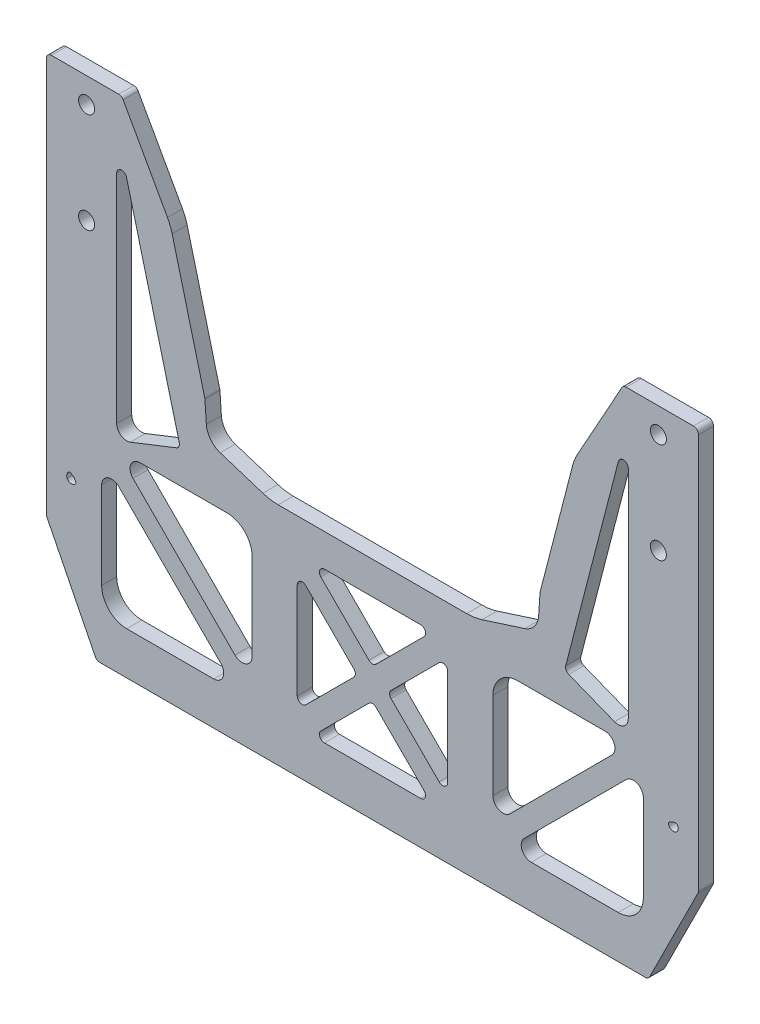
from build123d import *

# Parameters (mm, degrees)
SKETCH_1_W              = 130
SKETCH_1_H              = 100
EXTRUDE_1_DEPTH         = 3
CHAMFER_1_SIZE          = 10
CHAMFER_1_SIZE2         = 20
CHAMFER_2_SIZE          = 20
CHAMFER_2_SIZE2         = 10
SKETCH_2_R              = 1.6
CUT_EXTRUDE_1_DEPTH     = 83.060952956
CUT_EXTRUDE_2_DEPTH     = 83.060952956
CHAMFER_3_SIZE          = 10
FILLET_2_R              = 5
CUT_EXTRUDE_6_DEPTH     = 10
FILLET_5_R              = 10
SKETCH_11_W             = 30
SKETCH_11_H             = 30
CUT_EXTRUDE_7_DEPTH     = 10
FILLET_6_R              = 5
EXTRUDE_2_DEPTH         = 3
FILLET_7_R              = 1
CUT_EXTRUDE_8_DEPTH     = 10
FILLET_8_R              = 1
FILLET_9_DEPTH          = 3
MIRROR_1_DEPTH          = 3
EXTRUDE_3_DEPTH         = 3
FILLET_10_R             = 2
CUT_EXTRUDE_9_DEPTH     = 10
FILLET_11_R             = 4
FILLET_11_OF_MIRROR_3_R = 4
FILLET_12_R             = 1


with BuildPart() as part:
    # 草图1 → 凸台-拉伸1 (new body)
    with BuildSketch(Plane.XY):
        Rectangle(SKETCH_1_W, SKETCH_1_H)
    extrude(amount=EXTRUDE_1_DEPTH)

    # 倒角1
    chamfer_1_edges = [part.edges().sort_by_distance(p)[0] for p in [
        (65, -50, 1.5),
    ]]
    chamfer_1_side = [part.faces().sort_by_distance(p)[0] for p in [
        (0, -50, 1.5),
    ]]
    chamfer(chamfer_1_edges, length=CHAMFER_1_SIZE, length2=CHAMFER_1_SIZE2, reference=chamfer_1_side[0])

    # 倒角2
    chamfer_2_edges = [part.edges().sort_by_distance(p)[0] for p in [
        (-65, -50, 1.5),
    ]]
    chamfer_2_side = [part.faces().sort_by_distance(p)[0] for p in [
        (-65, 0, 1.5),
    ]]
    chamfer(chamfer_2_edges, length=CHAMFER_2_SIZE, length2=CHAMFER_2_SIZE2, reference=chamfer_2_side[0])

    # 草图2 → 切除-拉伸1 (cut, through all)
    with BuildSketch(Plane.XY.offset(3)):
        with Locations((57, 45)):
            Circle(SKETCH_2_R)
        with Locations((57, 25)):
            Circle(SKETCH_2_R)
        with Locations(Location((-57, 25, 0), (0, 0, 180))):
            Circle(SKETCH_2_R)
        with Locations(Location((-57, 45, 0), (0, 0, 180))):
            Circle(SKETCH_2_R)
    extrude(amount=-CUT_EXTRUDE_1_DEPTH, mode=Mode.SUBTRACT)

    # 草图3 → 切除-拉伸2 (cut, through all)
    with BuildSketch(Plane.XY.offset(3)):
        Polygon((-50, 50), (-25, 5), (25, 5), (50, 50), align=None)
    extrude(amount=-CUT_EXTRUDE_2_DEPTH, mode=Mode.SUBTRACT)

    # 倒角3
    chamfer_3_edges = [part.edges().sort_by_distance(p)[0] for p in [
        (25, 5, 1.5),
        (-25, 5, 1.5),
    ]]
    chamfer(chamfer_3_edges, length=CHAMFER_3_SIZE)

    # 圆角2
    fillet_2_edges = [part.edges().sort_by_distance(p)[0] for p in [
        (29.856429312, 13.741572761, 1.5),
        (-15, 5, 1.5),
        (15, 5, 1.5),
        (-29.856429312, 13.741572761, 1.5),
    ]]
    fillet(fillet_2_edges, radius=FILLET_2_R)

    # 草图9 → 切除-拉伸6 (cut)
    with BuildSketch(Plane(origin=(0, 0, 0), x_dir=(-1, 0, 0), z_dir=(0, 0, -1))):
        Polygon((-8.056483751, -5), (8.056483751, -5), (22, -5), (32.5, 2.5), (40.258907557, 32.466033603), (-40.258907557, 32.466033603), (-32.5, 2.5), (-22, -5), align=None)
    extrude(amount=-CUT_EXTRUDE_6_DEPTH, mode=Mode.SUBTRACT)

    # 圆角5
    fillet_5_edges = [part.edges().sort_by_distance(p)[0] for p in [
        (-40.258907557, 32.466033603, 1.5),
        (22, -5, 1.5),
        (32.5, 2.5, 1.5),
        (40.258907557, 32.466033603, 1.5),
        (-32.5, 2.5, 1.5),
        (-22, -5, 1.5),
    ]]
    fillet(fillet_5_edges, radius=FILLET_5_R)

    # 草图11 → 切除-拉伸7 (cut)
    with BuildSketch(Plane(origin=(0, 0, 0), x_dir=(-1, 0, 0), z_dir=(0, 0, -1))):
        with Locations((0, -26.5)):
            Rectangle(SKETCH_11_W, SKETCH_11_H)
        with Locations((39, -26.5)):
            Rectangle(SKETCH_11_W, SKETCH_11_H)
        with Locations((-39, -26.5)):
            Rectangle(SKETCH_11_W, SKETCH_11_H)
    extrude(amount=-CUT_EXTRUDE_7_DEPTH, mode=Mode.SUBTRACT)

    # 圆角6
    fillet_6_edges = [part.edges().sort_by_distance(p)[0] for p in [
        (24, -11.5, 1.5),
        (24, -41.5, 1.5),
        (54, -41.5, 1.5),
        (54, -11.5, 1.5),
        (-54, -11.5, 1.5),
        (-54, -41.5, 1.5),
        (-24, -41.5, 1.5),
        (-24, -11.5, 1.5),
    ]]
    fillet(fillet_6_edges, radius=FILLET_6_R)

    # 草图12 → 凸台-拉伸2 (add)
    with BuildSketch(Plane.XY.offset(3)):
        Polygon((0, -23.5), (-12, -11.5), (-15, -14.5), (-3, -26.5), align=None)
        Polygon((-15, -14.5), (-12, -11.5), (-15, -11.5), align=None)
        Polygon((3, -26.5), (0, -23.5), (-3, -26.5), (0, -29.5), align=None)
        Polygon((15, -38.5), (3, -26.5), (0, -29.5), (12, -41.5), align=None)
        Polygon((12, -11.5), (0, -23.5), (3, -26.5), (15, -14.5), align=None)
        Polygon((15, -11.5), (12, -11.5), (15, -14.5), align=None)
        Polygon((15, -41.5), (15, -38.5), (12, -41.5), align=None)
        Polygon((0, -29.5), (-3, -26.5), (-15, -38.5), (-12, -41.5), align=None)
        Polygon((-12, -41.5), (-15, -38.5), (-15, -41.5), align=None)
    extrude(amount=-EXTRUDE_2_DEPTH)

    # 圆角7
    fillet_7_edges = [part.edges().sort_by_distance(p)[0] for p in [
        (-3, -26.5, 1.5),
        (-15, -14.5, 1.5),
        (-12, -11.5, 1.5),
        (0, -23.5, 1.5),
        (12, -11.5, 1.5),
        (15, -14.5, 1.5),
        (3, -26.5, 1.5),
        (15, -38.5, 1.5),
        (12, -41.5, 1.5),
        (0, -29.5, 1.5),
        (-12, -41.5, 1.5),
        (-15, -38.5, 1.5),
    ]]
    fillet(fillet_7_edges, radius=FILLET_7_R)

    # 草图13 → 切除-拉伸8 (cut)
    with BuildSketch(Plane.XY.offset(3)):
        Polygon((-51, -10), (-51, 44.02839295), (-38.305401388, -5), align=None)
        Polygon((-61.351808176, -20.525873817), (-59, -19.599571123), (-59, -25.229490169), align=None)
    extrude(amount=-CUT_EXTRUDE_8_DEPTH, mode=Mode.SUBTRACT)

    # 圆角8
    # the kernel refuses this fillet: 1 mm, written as the material it adds along each edge
    with BuildSketch(Plane(origin=(-59, -25.229490169, 3), x_dir=(0, 1, 0), z_dir=(0, 0, -1))) as fillet_8_piece_1:
        with BuildLine():
            CenterArc((FILLET_8_R * 4.2360679775, -FILLET_8_R), FILLET_8_R, 90, 153.434948823)
            Line((FILLET_8_R * 3.788854382, -FILLET_8_R * 1.894427191), (0, 0))
            Line((0, 0), (FILLET_8_R * 4.2360679775, 0))
        make_face()
    extrude(amount=3)
    with BuildSketch(Plane(origin=(-61.351808176, -20.525873817, 3), x_dir=(0.4472135954999554, -0.8944271909999172, 0), z_dir=(0, 0, -1))) as fillet_8_piece_2:
        with BuildLine():
            CenterArc((FILLET_8_R * 1.09259307551, -FILLET_8_R), FILLET_8_R, 90, 95.067143002)
            Line((FILLET_8_R * 0.0965011963042, -FILLET_8_R * 1.08832308978), (0, 0))
            Line((0, 0), (FILLET_8_R * 1.09259307551, 0))
        make_face()
    extrude(amount=3)
    with BuildSketch(Plane(origin=(-38.305401388, -5, 3), x_dir=(-0.25065749455112574, 0.9680758340261121, 0), z_dir=(0, 0, -1))) as fillet_8_piece_3:
        with BuildLine():
            CenterArc((FILLET_8_R * 0.885013342736, -FILLET_8_R), FILLET_8_R, 90, 83.018514551)
            Line((-FILLET_8_R * 0.107572137929, -FILLET_8_R * 0.878451394195), (0, 0))
            Line((0, 0), (FILLET_8_R * 0.885013342736, 0))
        make_face()
    extrude(amount=3)
    with BuildSketch(Plane(origin=(-51, 44.02839295, 3), x_dir=(0.2506574945511292, -0.9680758340261111, 0), z_dir=(0, 0, -1))) as fillet_8_piece_4:
        with BuildLine():
            CenterArc((FILLET_8_R * 7.85165365811, FILLET_8_R), FILLET_8_R, 104.516422726, 165.483577274)
            Line((FILLET_8_R * 7.60099616356, FILLET_8_R * 1.96807583403), (0, 0))
            Line((0, 0), (FILLET_8_R * 7.85165365811, 0))
        make_face()
    extrude(amount=3)

    # 圆角9: read off the stored shape, not the designer's step
    # 圆角9 outline → 圆角9 (add)
    with BuildSketch(Plane.XY):
        with BuildLine():
            ThreePointArc((-60.335225765, -20.125474228), (-59.561658448, -20.622093604), (-59.09195416, -21.412292997))
            ThreePointArc((-59.09195416, -21.412292997), (-59.023259031, -21.207844858), (-59, -20.993422191))
            Line((-59, -20.993422191), (-59, -19.599571123))
            Line((-59, -19.599571123), (-60.335225765, -20.125474228))
        make_face()
        with BuildLine():
            Line((-51, -10), (-48.267065485, -8.923583723))
            ThreePointArc((-48.267065485, -8.923583723), (-50.125640033, -8.715880777), (-51, -7.062721827))
            Line((-51, -7.062721827), (-51, -10))
        make_face()
    extrude(amount=FILLET_9_DEPTH)

    # 镜向1: read off the stored shape, not the designer's step
    # 镜向1 outline → 镜向1 (cut)
    with BuildSketch(Plane.XY):
        with BuildLine():
            Line((39.128845192, -5.324328413), (48.267065485, -8.923583723))
            ThreePointArc((48.267065485, -8.923583723), (50.125640033, -8.715880777), (51, -7.062721827))
            Line((51, -7.062721827), (51, 36.176739291))
            ThreePointArc((51, 36.176739291), (50.126341138, 37.168726145), (49.031924166, 36.427396786))
            Line((49.031924166, 36.427396786), (38.527236615, -4.14323997))
            ThreePointArc((38.527236615, -4.14323997), (38.604249156, -4.847776531), (39.128845192, -5.324328413))
        make_face()
        with BuildLine():
            ThreePointArc((60.87826066, -21.471604387), (60.952073511, -20.8739942), (60.66934984, -20.342342436))
            ThreePointArc((60.66934984, -20.342342436), (59.757682696, -20.470476456), (59, -20.993422191))
            ThreePointArc((59, -20.993422191), (59.753282206, -21.962509561), (60.87826066, -21.471604387))
        make_face()
    extrude(amount=MIRROR_1_DEPTH, mode=Mode.SUBTRACT)

    # 草图14 → 凸台-拉伸3 (add)
    with BuildSketch(Plane.XY.offset(3)):
        with BuildLine():
            Line((53.654583912, -14.673843213), (27.173843213, -41.154583912))
            ThreePointArc((27.173843213, -41.154583912), (25.464466094, -40.035533906), (24.345416088, -38.326156787))
            Line((24.345416088, -38.326156787), (50.826156787, -11.845416088))
            ThreePointArc((50.826156787, -11.845416088), (52.535533906, -12.964466094), (53.654583912, -14.673843213))
        make_face()
    extrude_3 = extrude(amount=-EXTRUDE_3_DEPTH)

    # 镜向2: 凸台-拉伸3 across plane
    add(extrude_3.mirror(Plane(origin=(0, 0, 0), x_dir=(0, 0, 1), z_dir=(1, 0, 0))))

    # 圆角10
    # the kernel refuses this fillet: 2 mm, written as the material it adds along each edge
    with BuildSketch(Plane(origin=(53.654583912, -14.673843213, 3), x_dir=(-0.7071067811865462, -0.7071067811865487, 0), z_dir=(0, 0, -1)), Plane(origin=(24.345416088, -38.326156787, 3), x_dir=(0.707106781186547, 0.7071067811865479, 0), z_dir=(0, 0, -1))) as fillet_10_piece_1:
        with BuildLine():
            CenterArc((4.339935008, -2), FILLET_10_R, 90, 135)
            Line((2.925721445, -3.414213562), (2.784300089, -3.555634919))
            ThreePointArc((2.784300089, -3.555634919), (0.905620433, -1.676955262), (-0.183303028, -0.08))
            Line((-0.183303028, -0.08), (0, 0.2))
            Line((0, 0.2), (4.339935008, 0.2))
            Line((4.339935008, 0.2), (4.339935008, 0))
        make_face()
    extrude(amount=3)
    with BuildSketch(Plane(origin=(27.173843213, -41.154583912, 3), x_dir=(0.9970447988650374, -0.07682232134072318, 0), z_dir=(0, 0, -1)), Plane(origin=(50.826156787, -11.845416088, 3), x_dir=(-0.9970447988650375, 0.07682232134072099, 0), z_dir=(0, 0, -1)), Plane(origin=(-53.654583912, -14.673843213, 3), x_dir=(-0.07682232134072965, -0.9970447988650367, 0), z_dir=(0, 0, -1)), Plane(origin=(-24.345416088, -38.326156787, 3), x_dir=(0.07682232134072216, 0.9970447988650374, 0), z_dir=(0, 0, -1))) as fillet_10_piece_2:
        with BuildLine():
            CenterArc((4.34265386, -1.994089598), FILLET_10_R, 85.594064217, 135)
            Line((2.823976414, -3.295480706), (2.67210867, -3.425619817))
            Line((2.67210867, -3.425619817), (-0.151867745, -0.130139111))
            Line((-0.151867745, -0.130139111), (-0.058527367, 0.191244731))
            ThreePointArc((-0.058527367, 0.191244731), (1.862660256, 0.403514671), (4.511662967, 0.19940896))
            Line((4.511662967, 0.19940896), (4.496298503, 0))
        make_face()
    extrude(amount=3)
    with BuildSketch(Plane(origin=(-27.173843213, -41.154583912, 3), x_dir=(-0.9970447988650369, -0.07682232134072821, 0), z_dir=(0, 0, -1)), Plane(origin=(-50.826156787, -11.845416088, 3), x_dir=(0.9970447988650375, 0.07682232134071967, 0), z_dir=(0, 0, -1))) as fillet_10_piece_3:
        with BuildLine():
            CenterArc((4.34265386, 1.994089598), FILLET_10_R, 139.405935783, 135)
            Line((2.823976414, 3.295480706), (2.67210867, 3.425619817))
            Line((2.67210867, 3.425619817), (-0.151867745, 0.130139111))
            Line((-0.151867745, 0.130139111), (-0.058527367, -0.191244731))
            ThreePointArc((-0.058527367, -0.191244731), (1.862660256, -0.403514671), (4.511662967, -0.19940896))
            Line((4.511662967, -0.19940896), (4.496298503, 0))
        make_face()
    extrude(amount=3)

    # 草图15 → 切除-拉伸9 (cut)
    with BuildSketch(Plane.XY.offset(3)):
        Polygon((33.410978737, 6.018332862), (32.945861228, -0.966197595), (21.847123776, -4.522955085), align=None)
    cut_extrude_9 = extrude(amount=-CUT_EXTRUDE_9_DEPTH, mode=Mode.SUBTRACT)

    # 圆角11
    fillet_11_edges = [part.edges().sort_by_distance(p)[0] for p in [
        (32.945861228, -0.966197595, 1.5),
    ]]
    fillet(fillet_11_edges, radius=FILLET_11_R)

    # 镜向3: 切除-拉伸9 across plane
    add(cut_extrude_9.mirror(Plane(origin=(0, 0, 0), x_dir=(0, 0, 1), z_dir=(1, 0, 0))), mode=Mode.SUBTRACT)

    # 圆角11 of 镜向3
    fillet_11_of_mirror_3_edges = [part.edges().sort_by_distance(p)[0] for p in [
        (-32.945861228, -0.966197595, 1.5),
    ]]
    fillet(fillet_11_of_mirror_3_edges, radius=FILLET_11_OF_MIRROR_3_R)

    # 圆角12
    fillet_12_edges = [part.edges().sort_by_distance(p)[0] for p in [
        (65, -30, 1.5),
        (-33.410978737, 6.018332862, 1.5),
        (33.410978737, 6.018332862, 1.5),
        (55, -50, 1.5),
        (-55, -50, 1.5),
        (-65, -30, 1.5),
        (-50, 50, 1.5),
        (50, 50, 1.5),
        (-65, 50, 1.5),
        (65, 50, 1.5),
    ]]
    fillet(fillet_12_edges, radius=FILLET_12_R)


solid = part.part
